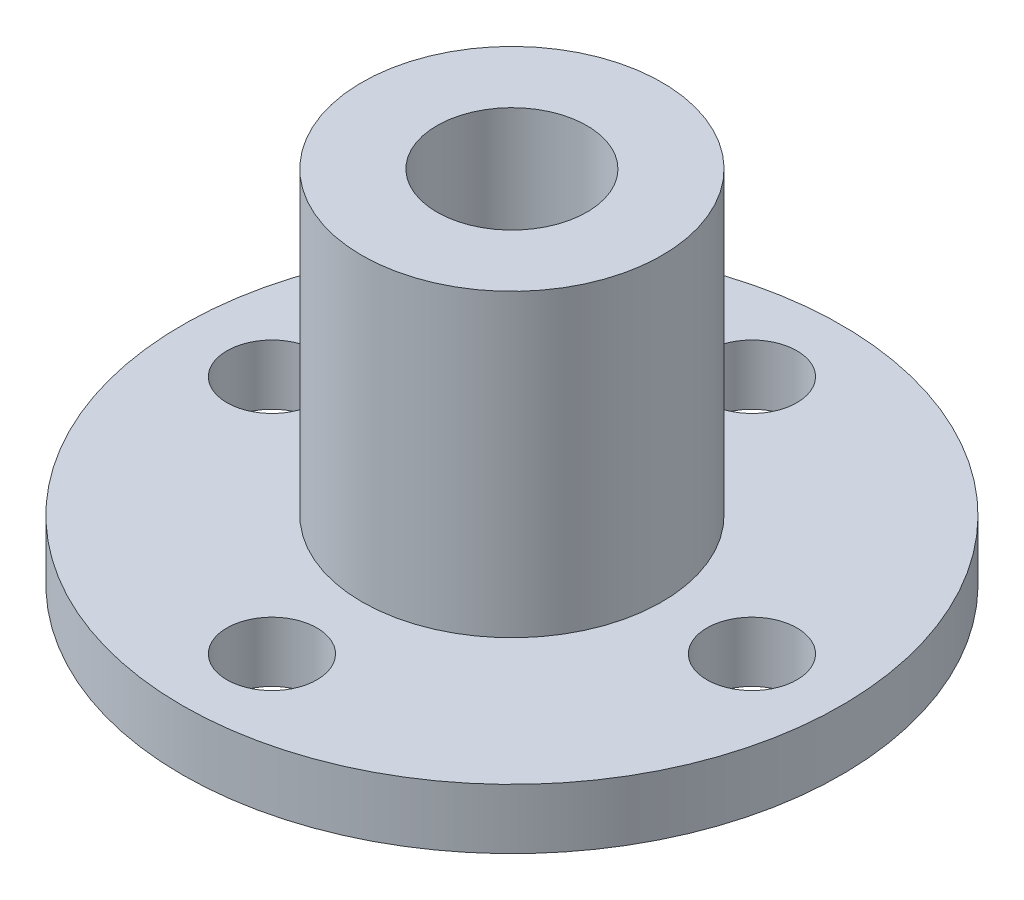
from build123d import *

# Parameters (mm, degrees)
SKETCH1_R               = 10.9855
BOSS_EXTRUDE1_DEPTH     = 2
SKETCH3_R               = 5
BOSS_EXTRUDE2_DEPTH     = 10
CUT_EXTRUDE1_DEPTH      = 19.475995792
CUT_EXTRUDE1_DEPTH_BACK = 19.475995792
SKETCH2_R               = 2.5
SKETCH4_R               = 1.5
CUT_EXTRUDE2_DEPTH      = 10


with BuildPart() as part:
    # Sketch1 → Boss-Extrude1 (new body)
    with BuildSketch(Plane(origin=(0, 0, 0), x_dir=(1, 0, 0), z_dir=(0, 1, 0))):
        Circle(SKETCH1_R)
    extrude(amount=BOSS_EXTRUDE1_DEPTH)

    # Sketch3 → Boss-Extrude2 (add)
    with BuildSketch(Plane(origin=(0, 2, 0), x_dir=(1, 0, 0), z_dir=(0, 1, 0))):
        Circle(SKETCH3_R)
    extrude(amount=BOSS_EXTRUDE2_DEPTH)

    # Sketch2 → Cut-Extrude1 (cut, two sides: drawn at the far end of the back side and taken through both)
    with BuildSketch(Plane(origin=(0, 2, 0), x_dir=(1, 0, 0), z_dir=(0, 1, 0)).offset(-CUT_EXTRUDE1_DEPTH_BACK)):
        Circle(SKETCH2_R)
    extrude(amount=CUT_EXTRUDE1_DEPTH + CUT_EXTRUDE1_DEPTH_BACK, mode=Mode.SUBTRACT)

    # Sketch4 → Cut-Extrude2 (cut)
    with BuildSketch(Plane(origin=(0, 2, 0), x_dir=(1, 0, 0), z_dir=(0, 1, 0))):
        with Locations((8, 0)):
            Circle(SKETCH4_R)
        with Locations((0, -8)):
            Circle(SKETCH4_R)
        with Locations((-8, 0)):
            Circle(SKETCH4_R)
        with Locations((0, 8)):
            Circle(SKETCH4_R)
    extrude(amount=-CUT_EXTRUDE2_DEPTH, mode=Mode.SUBTRACT)


solid = part.part
